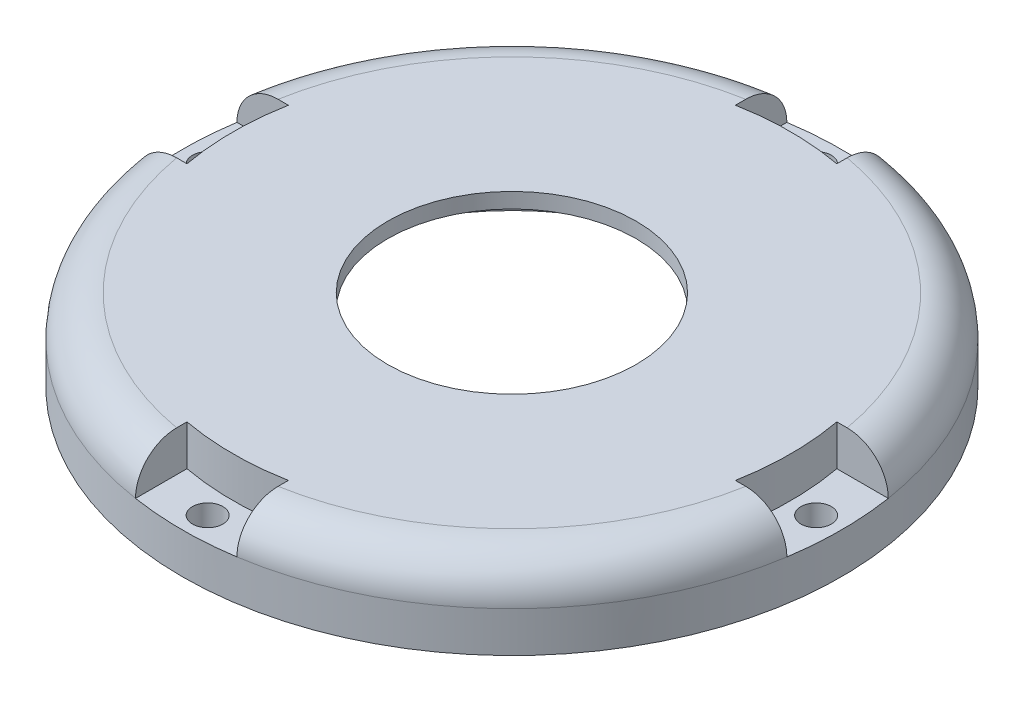
from build123d import *
from build123d.topology import SkipClean

# Parameters (mm, degrees)
SKETCH1_R           = 32.5
SKETCH1_R_2         = 27.5
BOSS_EXTRUDE1_DEPTH = 4
BOSS_EXTRUDE2_DEPTH = 4
SKETCH3_R           = 1.5
CUT_EXTRUDE1_DEPTH  = 6
BOSS_EXTRUDE4_START = -8
SKETCH7_R           = 25
BOSS_EXTRUDE4_DEPTH = 8
SKETCH8_R           = 27.5
SKETCH8_R_2         = 12.25
BOSS_EXTRUDE5_DEPTH = 4
SKETCH10_R          = 25
SKETCH10_R_2        = 12.25
BOSS_EXTRUDE6_DEPTH = 4
FILLET3_R           = 4
SKETCH11_R          = 21.25
CUT_EXTRUDE2_DEPTH  = 4
SKETCH14_R          = 18.5
CUT_EXTRUDE3_DEPTH  = 2.5


with BuildPart() as part:
    # Sketch1 → Boss-Extrude1 (new body)
    with BuildSketch(Plane(origin=(0, 0, 0), x_dir=(1, 0, 0), z_dir=(0, 1, 0))):
        with Locations(Location((0, 0, 0), (0, 0, 270))):
            Circle(SKETCH1_R)
        with Locations(Location((0, 0, 0), (0, 0, 270))):
            Circle(SKETCH1_R_2, mode=Mode.SUBTRACT)
    extrude(amount=BOSS_EXTRUDE1_DEPTH)

    # Sketch2 → Boss-Extrude2 (add)
    with SkipClean():  # the faces are left unmerged after this step: merging them gives an invalid solid
        with BuildSketch(Plane(origin=(0, 4, 0), x_dir=(1, 0, 0), z_dir=(0, 1, 0))):
            with BuildLine():
                ThreePointArc((-5, 32.113081447), (-22.980970389, 22.980970389), (-32.113081447, 5))
                Line((-32.113081447, 5), (-30, 5))
                Line((-30, 5), (-27.041634566, 5))
                ThreePointArc((-27.041634566, 5), (-19.445436483, 19.445436483), (-5, 27.041634566))
                Line((-5, 27.041634566), (-5, 32.113081447))
            make_face()
            with BuildLine():
                Line((-27.041634566, -5), (-32.113081447, -5))
                ThreePointArc((-32.113081447, -5), (-22.980970389, -22.980970389), (-5, -32.113081447))
                Line((-5, -32.113081447), (-5, -27.041634566))
                ThreePointArc((-5, -27.041634566), (-19.445436483, -19.445436483), (-27.041634566, -5))
            make_face()
            with BuildLine():
                Line((5, -27.041634566), (5, -32.113081447))
                ThreePointArc((5, -32.113081447), (22.980970389, -22.980970389), (32.113081447, -5))
                Line((32.113081447, -5), (27.041634566, -5))
                ThreePointArc((27.041634566, -5), (19.445436483, -19.445436483), (5, -27.041634566))
            make_face()
            with BuildLine():
                ThreePointArc((32.113081447, 5), (22.980970389, 22.980970389), (5, 32.113081447))
                Line((5, 32.113081447), (5, 27.041634566))
                ThreePointArc((5, 27.041634566), (19.445436483, 19.445436483), (27.041634566, 5))
                Line((27.041634566, 5), (32.113081447, 5))
            make_face()
        extrude(amount=BOSS_EXTRUDE2_DEPTH)

    # Sketch3 → Cut-Extrude1 (cut)
    with SkipClean():  # the faces are left unmerged after this step: merging them gives an invalid solid
        with BuildSketch(Plane(origin=(0, 4, 0), x_dir=(1, 0, 0), z_dir=(0, 1, 0))):
            with Locations(Location((0, 30, 0), (0, 0, 270))):
                Circle(SKETCH3_R)
            with Locations(Location((30, 0, 0), (0, 0, 270))):
                Circle(SKETCH3_R)
            with Locations(Location((0, -30, 0), (0, 0, 270))):
                Circle(SKETCH3_R)
            with Locations(Location((-30, 0, 0), (0, 0, 270))):
                Circle(SKETCH3_R)
        extrude(amount=-CUT_EXTRUDE1_DEPTH, mode=Mode.SUBTRACT)

    # Sketch7 → Boss-Extrude4 (add)
    # profile 1 of 5: a face of its own
    with BuildSketch(Plane(origin=(0, 8, 0), x_dir=(1, 0, 0), z_dir=(0, 1, 0)).offset(BOSS_EXTRUDE4_START)):
        with BuildLine():
            ThreePointArc((-27.041634566, 5), (-19.445436483, 19.445436483), (-5, 27.041634566))
            Line((-5, 27.041634566), (-5, 32.113081447))
            ThreePointArc((-5, 32.113081447), (-22.980970389, 22.980970389), (-32.113081447, 5))
            Line((-32.113081447, 5), (-27.041634566, 5))
        make_face()
    # profile 2 of 5: a face of its own
    with BuildSketch(Plane(origin=(0, 8, 0), x_dir=(1, 0, 0), z_dir=(0, 1, 0)).offset(BOSS_EXTRUDE4_START)):
        with BuildLine():
            Line((27.041634566, 5), (32.113081447, 5))
            ThreePointArc((32.113081447, 5), (22.980970389, 22.980970389), (5, 32.113081447))
            Line((5, 32.113081447), (5, 27.041634566))
            ThreePointArc((5, 27.041634566), (19.445436483, 19.445436483), (27.041634566, 5))
        make_face()
    # profile 3 of 5: a face of its own
    with BuildSketch(Plane(origin=(0, 8, 0), x_dir=(1, 0, 0), z_dir=(0, 1, 0)).offset(BOSS_EXTRUDE4_START)):
        with BuildLine():
            Line((5, -27.041634566), (5, -32.113081447))
            ThreePointArc((5, -32.113081447), (22.980970389, -22.980970389), (32.113081447, -5))
            Line((32.113081447, -5), (27.041634566, -5))
            ThreePointArc((27.041634566, -5), (19.445436483, -19.445436483), (5, -27.041634566))
        make_face()
    # profile 4 of 5: a face of its own
    with BuildSketch(Plane(origin=(0, 8, 0), x_dir=(1, 0, 0), z_dir=(0, 1, 0)).offset(BOSS_EXTRUDE4_START)):
        with BuildLine():
            Line((-27.041634566, -5), (-32.113081447, -5))
            ThreePointArc((-32.113081447, -5), (-22.980970389, -22.980970389), (-5, -32.113081447))
            Line((-5, -32.113081447), (-5, -27.041634566))
            ThreePointArc((-5, -27.041634566), (-19.445436483, -19.445436483), (-27.041634566, -5))
        make_face()
    # profile 5 of 5: a face of its own
    with BuildSketch(Plane(origin=(0, 8, 0), x_dir=(1, 0, 0), z_dir=(0, 1, 0)).offset(BOSS_EXTRUDE4_START)):
        with BuildLine():
            ThreePointArc((-27.041634566, -5), (-19.445436483, -19.445436483), (-5, -27.041634566))
            ThreePointArc((-5, -27.041634566), (0, -27.5), (5, -27.041634566))
            ThreePointArc((5, -27.041634566), (19.445436483, -19.445436483), (27.041634566, -5))
            ThreePointArc((27.041634566, -5), (27.385168893, -2.510482965), (27.5, 0))
            ThreePointArc((27.5, 0), (27.385168893, 2.510482965), (27.041634566, 5))
            ThreePointArc((27.041634566, 5), (19.445436483, 19.445436483), (5, 27.041634566))
            ThreePointArc((5, 27.041634566), (0, 27.5), (-5, 27.041634566))
            ThreePointArc((-5, 27.041634566), (-19.445436483, 19.445436483), (-27.041634566, 5))
            ThreePointArc((-27.041634566, 5), (-27.5, 0), (-27.041634566, -5))
        make_face()
        with Locations(Location((0, 0, 0), (0, 0, 270))):
            Circle(SKETCH7_R, mode=Mode.SUBTRACT)
    extrude(amount=BOSS_EXTRUDE4_DEPTH)

    # Sketch8 → Boss-Extrude5 (add)
    with BuildSketch(Plane(origin=(0, 0, 0), x_dir=(-1, 0, 0), z_dir=(0, -1, 0))):
        Circle(SKETCH8_R)
        with Locations(Location((0, 0, 0), (0, 0, 90))):
            Circle(SKETCH8_R_2, mode=Mode.SUBTRACT)
    extrude(amount=-BOSS_EXTRUDE5_DEPTH)

    # Sketch10 → Boss-Extrude6 (add)
    with BuildSketch(Plane(origin=(0, 4, 0), x_dir=(1, 0, 0), z_dir=(0, 1, 0))):
        Circle(SKETCH10_R)
        with Locations(Location((0, 0, 0), (0, 0, 90))):
            Circle(SKETCH10_R_2, mode=Mode.SUBTRACT)
    extrude(amount=BOSS_EXTRUDE6_DEPTH)

    # Fillet3
    fillet3_edges = [part.edges().sort_by_distance(p)[0] for p in [
        (22.980970389, 8, -22.980970389),
        (22.980970389, 8, 22.980970389),
        (-22.980970389, 8, 22.980970389),
        (-22.980970389, 8, -22.980970389),
    ]]
    fillet(fillet3_edges, radius=FILLET3_R - 0.0001)  # a hair under: the kernel refuses the full size

    # Sketch11 → Cut-Extrude2 (cut)
    with BuildSketch(Plane.XZ):
        with Locations(Location((0, 0, 0), (0, 0, 270))):
            Circle(SKETCH11_R)
    extrude(amount=-CUT_EXTRUDE2_DEPTH, mode=Mode.SUBTRACT)

    # Sketch14 → Cut-Extrude3 (cut)
    with BuildSketch(Plane.XZ.offset(-4)):
        with Locations(Location((0, 0, 0), (0, 0, 270))):
            Circle(SKETCH14_R)
    extrude(amount=-CUT_EXTRUDE3_DEPTH, mode=Mode.SUBTRACT)


solid = part.part
